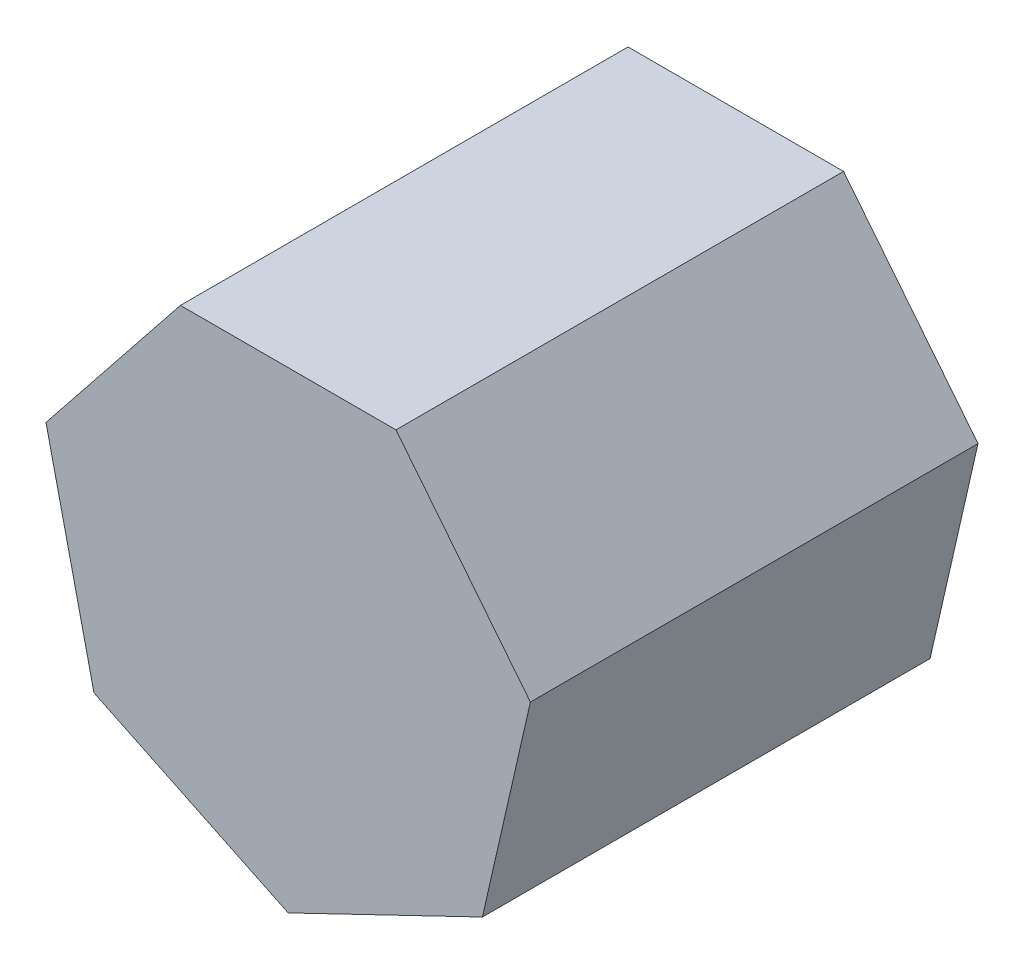
from build123d import *

# Parameters (mm, degrees)
BOSS_EXTRUDE1_DEPTH = 200
CUT_EXTRUDE1_DEPTH  = 1


with BuildPart() as part:
    # Sketch1 → Boss-Extrude1 (new body)
    with BuildSketch(Plane.XY):
        Polygon((0, -110.991626417), (86.776747824, -69.202147163), (108.208834613, 24.697960372), (48.157461881, 100), (-48.157461881, 100), (-108.208834613, 24.697960372), (-86.776747824, -69.202147163), align=None)
    extrude(amount=BOSS_EXTRUDE1_DEPTH)

    # Sketch2 → Cut-Extrude1 (cut)
    # profile 1 of 6: a face of its own
    with BuildSketch(Plane(origin=(-78.183148247, 62.348980186, 0), x_dir=(0, 0, 1), z_dir=(-0.7818314824680302, 0.6234898018587328, 0))):
        with BuildLine():
            Line((145.128205128, -35.364993932), (143.91025641, -36.619000342))
            add(Edge.make_bspline(
                [(143.91025641, -36.619000342), (143.805167819, -36.497210935), (143.602569386, -36.262415294), (143.281246637, -35.9484892), (142.961111759, -35.684849549), (142.64654711, -35.462265212), (142.329642716, -35.293984375), (142.014117469, -35.171156592), (141.699644678, -35.095146274), (141.489438762, -35.085349481), (141.386217949, -35.080538804)],
                knots=[0, 0, 0, 0, 1.26578478, 2.440284043, 3.530471711, 4.527705817, 5.468200915, 6.346673037, 7.188140097, 8, 8, 8, 8], degree=3))
            add(Edge.make_bspline(
                [(141.386217949, -35.080538804), (141.25970715, -35.086680935), (141.010751801, -35.09876778), (140.65403284, -35.219415954), (140.322886411, -35.404608745), (140.036275097, -35.667286365), (139.793488354, -35.968796473), (139.616267319, -36.305918329), (139.50789027, -36.668478579), (139.494148944, -36.920077766), (139.487179487, -37.04768624)],
                knots=[0, 0, 0, 0, 0.99966794, 1.967205029, 2.953328237, 3.988086729, 5.028030931, 6.008226631, 6.989793394, 8, 8, 8, 8], degree=3))
            add(Edge.make_bspline(
                [(139.487179487, -37.04768624), (139.493526986, -37.163183635), (139.50620409, -37.39385284), (139.604756542, -37.734127319), (139.761705526, -38.065881823), (139.908392351, -38.26909843), (139.983974359, -38.373808035)],
                knots=[0, 0, 0, 0, 0.960159726, 1.917612774, 2.927026955, 4, 4, 4, 4], degree=3))
            add(Edge.make_bspline(
                [(139.983974359, -38.373808035), (140.029480038, -38.429719945), (140.126333139, -38.5487214), (140.308096082, -38.713886276), (140.513938956, -38.896413425), (140.761481457, -39.078909636), (141.040058759, -39.271090923), (141.355711812, -39.465388826), (141.698423269, -39.676614111), (141.943779307, -39.810582314), (142.071314103, -39.880218291)],
                knots=[0, 0, 0, 0, 0.66740084, 1.420478572, 2.27185888, 3.217733974, 4.268547843, 5.408967954, 6.65319498, 8, 8, 8, 8], degree=3))
            add(Edge.make_bspline(
                [(142.071314103, -39.880218291), (142.226820257, -39.967332021), (142.527206943, -40.135607064), (142.954022756, -40.396805369), (143.341377276, -40.656413508), (143.69255252, -40.911655073), (144.000791428, -41.169671459), (144.275446014, -41.420572928), (144.509665694, -41.671940404), (144.640830989, -41.847558196), (144.703525641, -41.931500342)],
                knots=[0, 0, 0, 0, 1.27191281, 2.456916733, 3.569705269, 4.599008579, 5.553216877, 6.436649441, 7.252746552, 8, 8, 8, 8], degree=3))
            add(Edge.make_bspline(
                [(144.703525641, -41.931500342), (144.807585798, -42.101020845), (145.014684822, -42.438398109), (145.232160631, -42.99393198), (145.358219344, -43.583134851), (145.375717745, -43.986176109), (145.384615385, -44.191115727)],
                knots=[0, 0, 0, 0, 0.995354457, 1.980940102, 2.973342416, 4, 4, 4, 4], degree=3))
            add(Edge.make_bspline(
                [(145.384615385, -44.191115727), (145.380503763, -44.335510848), (145.372401363, -44.620057209), (145.316069552, -45.039113379), (145.219183973, -45.439882279), (145.087219665, -45.826712477), (144.909023248, -46.192192132), (144.700178693, -46.545542126), (144.449464911, -46.879118874), (144.163228479, -47.19248436), (143.849825657, -47.478688631), (143.515504866, -47.730254082), (143.159854405, -47.939250295), (142.78541554, -48.112195125), (142.391337517, -48.249728027), (141.977558721, -48.344942491), (141.545394409, -48.401929698), (141.251509791, -48.40984099), (141.101762821, -48.413872137)],
                knots=[0, 0, 0, 0, 1.032770009, 2.035186124, 3.017557409, 3.978232242, 4.952395191, 5.920591857, 6.910227898, 7.931268572, 8.952309245, 9.941945286, 10.918353717, 11.897095711, 12.887975737, 13.898235213, 14.929059601, 16, 16, 16, 16], degree=3))
            add(Edge.make_bspline(
                [(141.101762821, -48.413872137), (140.899664675, -48.408199564), (140.498276521, -48.396933237), (139.904620983, -48.291184316), (139.324502362, -48.126639208), (138.762310703, -47.899691013), (138.230618624, -47.613115511), (137.744156198, -47.269901833), (137.301233555, -46.881387562), (137.049129134, -46.583599501), (136.923076923, -46.43470547)],
                knots=[0, 0, 0, 0, 1.013940152, 2.01379169, 3.017749504, 4.037548394, 5.051665909, 6.043208538, 7.021604269, 8, 8, 8, 8], degree=3))
            Line((136.923076923, -46.43470547), (138.112980769, -45.080538804))
            add(Edge.make_bspline(
                [(138.112980769, -45.080538804), (138.225965986, -45.20256603), (138.445004913, -45.439134258), (138.795297581, -45.75413049), (139.151751301, -46.018137754), (139.510806653, -46.238957267), (139.877778621, -46.409102428), (140.250610702, -46.52863725), (140.628544554, -46.605461206), (140.88238533, -46.614479962), (141.009615385, -46.619000342)],
                knots=[0, 0, 0, 0, 1.179806542, 2.287233372, 3.337373186, 4.324005949, 5.273901747, 6.200048787, 7.097828587, 8, 8, 8, 8], degree=3))
            add(Edge.make_bspline(
                [(141.009615385, -46.619000342), (141.182860676, -46.611167057), (141.521352913, -46.595862133), (142.006174391, -46.456907321), (142.453823685, -46.239021882), (142.842528517, -45.929966464), (143.173398009, -45.570220335), (143.412987577, -45.164996796), (143.563137151, -44.726188472), (143.580771429, -44.422003886), (143.58974359, -44.267237522)],
                knots=[0, 0, 0, 0, 1.072336372, 2.095165389, 3.102688358, 4.141489647, 5.156069229, 6.117746104, 7.042326257, 8, 8, 8, 8], degree=3))
            add(Edge.make_bspline(
                [(143.58974359, -44.267237522), (143.583536194, -44.139753987), (143.571280521, -43.888054811), (143.475033252, -43.523767148), (143.322959811, -43.178228402), (143.173218963, -42.976001846), (143.096955128, -42.873006753)],
                knots=[0, 0, 0, 0, 1.013901739, 2.00181326, 2.98231254, 4, 4, 4, 4], degree=3))
            add(Edge.make_bspline(
                [(143.096955128, -42.873006753), (143.051112874, -42.821376112), (142.951251889, -42.708905929), (142.768079082, -42.546476907), (142.548754155, -42.371402054), (142.290810367, -42.186650118), (141.993727727, -41.994658087), (141.656302153, -41.796433217), (141.283156139, -41.582560499), (141.01932396, -41.440733897), (140.881410256, -41.366596496)],
                knots=[0, 0, 0, 0, 0.615000592, 1.339693406, 2.178160186, 3.116406724, 4.166410947, 5.330106347, 6.604359322, 8, 8, 8, 8], degree=3))
            add(Edge.make_bspline(
                [(140.881410256, -41.366596496), (140.732572313, -41.283515744), (140.443928042, -41.122395651), (140.035086379, -40.871446621), (139.666244355, -40.616205051), (139.328526786, -40.370988827), (139.030463897, -40.122869147), (138.773229907, -39.871570567), (138.546697245, -39.62722779), (138.421283463, -39.45410038), (138.361378205, -39.371404188)],
                knots=[0, 0, 0, 0, 1.262093308, 2.447601706, 3.550203992, 4.582594899, 5.537233252, 6.418365656, 7.244515135, 8, 8, 8, 8], degree=3))
            add(Edge.make_bspline(
                [(138.361378205, -39.371404188), (138.257774779, -39.204857817), (138.05053172, -38.871706872), (137.849302056, -38.315647005), (137.710981891, -37.730246678), (137.698625376, -37.326321796), (137.692307692, -37.119801624)],
                knots=[0, 0, 0, 0, 0.985009483, 1.970363186, 2.962279964, 4, 4, 4, 4], degree=3))
            add(Edge.make_bspline(
                [(137.692307692, -37.119801624), (137.695360237, -36.98479935), (137.701334499, -36.720580773), (137.749014794, -36.332358943), (137.835824572, -35.96351235), (137.944709844, -35.608501704), (138.096041298, -35.274204024), (138.276875042, -34.956161332), (138.489374613, -34.654813229), (138.734193418, -34.374795331), (139.003374248, -34.120456324), (139.294201504, -33.898749878), (139.600134398, -33.709570708), (139.922468224, -33.550912648), (140.264299498, -33.430904747), (140.623238849, -33.348291118), (140.998559734, -33.293118531), (141.255137597, -33.28818662), (141.386217949, -33.285667009)],
                knots=[0, 0, 0, 0, 1.087655834, 2.128696564, 3.144119009, 4.137814668, 5.115653402, 6.093965665, 7.082169637, 8.081268856, 9.086088321, 10.061021666, 11.022561449, 11.980240094, 12.950172527, 13.934149372, 14.944599409, 16, 16, 16, 16], degree=3))
            add(Edge.make_bspline(
                [(141.386217949, -33.285667009), (141.541601169, -33.291977527), (141.855282436, -33.304716943), (142.325880299, -33.405892317), (142.795785111, -33.572367198), (143.266204254, -33.802288531), (143.733691622, -34.099813536), (144.202359374, -34.459409533), (144.677833833, -34.878710759), (144.974727051, -35.199277761), (145.128205128, -35.364993932)],
                knots=[0, 0, 0, 0, 0.845714091, 1.707292901, 2.609013841, 3.555613372, 4.552488639, 5.621697636, 6.770543573, 8, 8, 8, 8], degree=3))
        make_face()
    # profile 2 of 6: a face of its own
    with BuildSketch(Plane(origin=(-78.183148247, 62.348980186, 0), x_dir=(0, 0, 1), z_dir=(-0.7818314824680302, 0.6234898018587328, 0))):
        with BuildLine():
            Line((132.251602564, -43.542077265), (133.846153846, -44.379417009))
            add(Edge.make_bspline(
                [(133.846153846, -44.379417009), (133.719087588, -44.604807473), (133.471866968, -45.043328061), (133.046719837, -45.645795835), (132.601050851, -46.187782783), (132.114742462, -46.654809379), (131.602344297, -47.06196015), (131.061014841, -47.418176291), (130.487935882, -47.721710693), (129.883080312, -47.977439424), (129.241368591, -48.174065104), (128.56124564, -48.312946367), (127.841408524, -48.398793616), (127.348001782, -48.408765849), (127.095352564, -48.413872137)],
                knots=[0, 0, 0, 0, 1.120438281, 2.179929193, 3.190490725, 4.156257408, 5.095198341, 6.022838206, 6.959905092, 7.901321166, 8.864066838, 9.862729781, 10.905609505, 12, 12, 12, 12], degree=3))
            add(Edge.make_bspline(
                [(127.095352564, -48.413872137), (126.814541264, -48.40731685), (126.266759769, -48.394529383), (125.469389785, -48.284286729), (124.718650252, -48.104444679), (124.014583375, -47.853213013), (123.35891336, -47.525056876), (122.750337047, -47.125288408), (122.185654042, -46.655961239), (121.682658561, -46.113010133), (121.229836374, -45.531970377), (120.83026026, -44.92650818), (120.496217797, -44.298146897), (120.224488596, -43.65088676), (120.005032225, -42.988807368), (119.852079632, -42.305884696), (119.763909643, -41.603967072), (119.750398526, -41.129125154), (119.743589744, -40.889833676)],
                knots=[0, 0, 0, 0, 1.145258523, 2.234067595, 3.276747158, 4.290159414, 5.277019952, 6.260822364, 7.254936242, 8.264827045, 9.274100331, 10.257902744, 11.220704747, 12.172965371, 13.118907548, 14.062713208, 15.023725156, 16, 16, 16, 16], degree=3))
            add(Edge.make_bspline(
                [(119.743589744, -40.889833676), (119.74964198, -40.665291788), (119.761636713, -40.220279418), (119.837241212, -39.561619163), (119.971231458, -38.921456578), (120.155096166, -38.299259732), (120.392531859, -37.696070395), (120.683001683, -37.11152146), (121.026958127, -36.546234946), (121.292516263, -36.189645611), (121.426282051, -36.010025983)],
                knots=[0, 0, 0, 0, 1.024358464, 2.0301432, 3.019427413, 4.004406732, 4.986367066, 5.972626655, 6.978780325, 8, 8, 8, 8], degree=3))
            add(Edge.make_bspline(
                [(121.426282051, -36.010025983), (121.60746881, -35.79363244), (121.964102791, -35.367700152), (122.567281964, -34.808052576), (123.220425943, -34.339231003), (123.915349521, -33.950618797), (124.660129373, -33.655340814), (125.444753893, -33.435297487), (126.278157243, -33.311994567), (126.847901362, -33.294578375), (127.139423077, -33.285667009)],
                knots=[0, 0, 0, 0, 1.030682036, 2.02871468, 2.997146059, 3.962720338, 4.930598197, 5.918074684, 6.934738563, 8, 8, 8, 8], degree=3))
            add(Edge.make_bspline(
                [(127.139423077, -33.285667009), (127.439123679, -33.293404431), (128.027067941, -33.30858349), (128.884394347, -33.449305395), (129.695598442, -33.67246285), (130.460355609, -33.987627367), (131.178743385, -34.394253377), (131.84609224, -34.897921043), (132.473815168, -35.483167255), (132.839007048, -35.933242738), (133.024839744, -36.162269573)],
                knots=[0, 0, 0, 0, 1.056321875, 2.072262726, 3.055038591, 4.01806755, 4.982017516, 5.957941055, 6.960871419, 8, 8, 8, 8], degree=3))
            add(Edge.make_bspline(
                [(133.024839744, -36.162269573), (133.151279391, -36.334861467), (133.403317066, -36.678896431), (133.71901478, -37.239874471), (133.993057037, -37.826792153), (134.212102529, -38.449136708), (134.389471107, -39.099534309), (134.517795786, -39.782634564), (134.593050749, -40.498234058), (134.607843305, -40.985814375), (134.615384615, -41.234384958)],
                knots=[0, 0, 0, 0, 0.94817472, 1.890038105, 2.849395472, 3.817997239, 4.812318967, 5.836947057, 6.897266129, 8, 8, 8, 8], degree=3))
            Line((134.615384615, -41.234384958), (121.538461538, -41.234384958))
            add(Edge.make_bspline(
                [(121.538461538, -41.234384958), (121.547259289, -41.426959039), (121.564559712, -41.805648203), (121.645217673, -42.359766964), (121.772353523, -42.887614633), (121.951033881, -43.385232016), (122.167415854, -43.859118459), (122.432477093, -44.30575867), (122.748703115, -44.723118271), (123.101421398, -45.114930485), (123.494033371, -45.463849121), (123.907077641, -45.776144985), (124.346469441, -46.037891252), (124.808744203, -46.250347765), (125.293154404, -46.416669571), (125.799852662, -46.530199975), (126.327841898, -46.606240585), (126.687760379, -46.614695815), (126.87099359, -46.619000342)],
                knots=[0, 0, 0, 0, 1.094153842, 2.151609401, 3.174256925, 4.172055639, 5.149267565, 6.128595816, 7.11444997, 8.118368179, 9.117203808, 10.09244225, 11.054858984, 12.015122123, 12.976791628, 13.957293641, 14.960065497, 16, 16, 16, 16], degree=3))
            add(Edge.make_bspline(
                [(126.87099359, -46.619000342), (127.050143005, -46.615525733), (127.40560981, -46.608631441), (127.934986138, -46.54159195), (128.455783437, -46.433190375), (128.965846199, -46.285247575), (129.454822461, -46.10480842), (129.907654176, -45.887077805), (130.324112551, -45.646222109), (130.71335236, -45.370738252), (131.090900893, -45.033548612), (131.465429387, -44.612773063), (131.867010263, -44.115130047), (132.118379365, -43.740583384), (132.251602564, -43.542077265)],
                knots=[0, 0, 0, 0, 0.99110716, 1.966546729, 2.947904876, 3.932708344, 4.903319531, 5.828989031, 6.710028674, 7.56322171, 8.463672341, 9.504779593, 10.677557249, 12, 12, 12, 12], degree=3))
        make_face()
        with BuildLine():
            add(Edge.make_bspline(
                [(132.820512821, -39.439513163), (132.754817823, -39.201439599), (132.6283761, -38.743224624), (132.364168303, -38.10870525), (132.066616642, -37.544774387), (131.714492463, -37.055747912), (131.315528317, -36.621442124), (130.854698701, -36.241907352), (130.337922167, -35.90237906), (129.767869935, -35.615793349), (129.164202592, -35.371851299), (128.532167209, -35.208279209), (127.887265564, -35.096224681), (127.451069642, -35.085789776), (127.231570513, -35.080538804)],
                knots=[0, 0, 0, 0, 1.154881502, 2.222775134, 3.210006277, 4.132804581, 5.035138423, 5.962687519, 6.919655026, 7.923214229, 8.944639381, 9.960483929, 10.97369054, 12, 12, 12, 12], degree=3))
            add(Edge.make_bspline(
                [(127.231570513, -35.080538804), (127.052430864, -35.08403407), (126.698309441, -35.090943476), (126.176589051, -35.156487072), (125.6755622, -35.264829043), (125.191531985, -35.413200223), (124.730841309, -35.610963666), (124.284014062, -35.842867818), (123.862411798, -36.125962583), (123.598747252, -36.341727468), (123.465544872, -36.450731112)],
                knots=[0, 0, 0, 0, 1.04873581, 2.073130211, 3.073294108, 4.04793562, 5.032784715, 6.005352987, 6.992311501, 8, 8, 8, 8], degree=3))
            add(Edge.make_bspline(
                [(123.465544872, -36.450731112), (123.370154689, -36.536984344), (123.177108208, -36.711539864), (122.919162371, -37.012278187), (122.672188241, -37.336572828), (122.447424511, -37.696830683), (122.241266874, -38.08894942), (122.048352719, -38.509621621), (121.874716078, -38.962039509), (121.777024021, -39.27731059), (121.726762821, -39.439513163)],
                knots=[0, 0, 0, 0, 0.879870761, 1.780643979, 2.707998968, 3.669668524, 4.684282772, 5.740141944, 6.837334558, 8, 8, 8, 8], degree=3))
            Line((121.726762821, -39.439513163), (132.820512821, -39.439513163))
        make_face(mode=Mode.SUBTRACT)
    # profile 3 of 6: a face of its own
    with BuildSketch(Plane(origin=(-78.183148247, 62.348980186, 0), x_dir=(0, 0, 1), z_dir=(-0.7818314824680302, 0.6234898018587328, 0))):
        with BuildLine():
            Line((111.538461538, -33.542077265), (113.333333333, -33.542077265))
            Line((113.333333333, -33.542077265), (113.333333333, -35.693519573))
            add(Edge.make_bspline(
                [(113.333333333, -35.693519573), (113.465840526, -35.493200554), (113.719259503, -35.110091987), (114.140476242, -34.603410267), (114.571923849, -34.183895715), (115.015667777, -33.849589893), (115.474971205, -33.599229214), (115.939753786, -33.415840442), (116.4173279, -33.307398641), (116.738253181, -33.29292059), (116.899038462, -33.285667009)],
                knots=[0, 0, 0, 0, 1.2804753, 2.448899062, 3.506932113, 4.484331642, 5.4025378, 6.288909075, 7.142734305, 8, 8, 8, 8], degree=3))
            add(Edge.make_bspline(
                [(116.899038462, -33.285667009), (117.023760327, -33.292470018), (117.280383671, -33.306467651), (117.668855613, -33.404815221), (118.06910391, -33.561832493), (118.327060408, -33.709490908), (118.461538462, -33.786468291)],
                knots=[0, 0, 0, 0, 0.901110191, 1.854092781, 2.881294221, 4, 4, 4, 4], degree=3))
            Line((118.461538462, -33.786468291), (117.475961538, -35.34095547))
            add(Edge.make_bspline(
                [(117.475961538, -35.34095547), (117.389624275, -35.302439664), (117.22573962, -35.22932929), (116.985999242, -35.142803518), (116.764963032, -35.091855428), (116.624142698, -35.084137042), (116.55849359, -35.080538804)],
                knots=[0, 0, 0, 0, 1.180555205, 2.24091978, 3.179933427, 4, 4, 4, 4], degree=3))
            add(Edge.make_bspline(
                [(116.55849359, -35.080538804), (116.414460827, -35.090139017), (116.120675741, -35.10972067), (115.689335745, -35.263656715), (115.270780285, -35.512372372), (114.938370786, -35.788207297), (114.680986483, -36.054194711), (114.497328052, -36.286471297), (114.328855212, -36.54692062), (114.167882524, -36.831090242), (114.021217986, -37.143832219), (113.884334162, -37.48202201), (113.760569231, -37.846051318), (113.689996407, -38.099665719), (113.653846154, -38.229577265)],
                knots=[0, 0, 0, 0, 1.125678352, 2.296057538, 3.5422874, 4.923748041, 5.663163013, 6.437101912, 7.23742474, 8.08941207, 8.991984279, 9.93940061, 10.944477711, 12, 12, 12, 12], degree=3))
            add(Edge.make_bspline(
                [(113.653846154, -38.229577265), (113.626803906, -38.345446829), (113.566907382, -38.602089107), (113.508670023, -39.032652105), (113.45112992, -39.541358727), (113.410577815, -40.129624972), (113.372989003, -40.795981794), (113.351788533, -41.54144434), (113.334056302, -42.366777776), (113.333581634, -42.94377408), (113.333333333, -43.245602906)],
                knots=[0, 0, 0, 0, 0.566838948, 1.255505196, 2.06880316, 3.007127437, 4.065329342, 5.249902469, 6.561414163, 8, 8, 8, 8], degree=3))
            Line((113.333333333, -43.245602906), (113.333333333, -48.157461881))
            Line((113.333333333, -48.157461881), (111.538461538, -48.157461881))
            Line((111.538461538, -48.157461881), (111.538461538, -33.542077265))
        make_face()
    # profile 4 of 6: a face of its own
    with BuildSketch(Plane(origin=(-78.183148247, 62.348980186, 0), x_dir=(0, 0, 1), z_dir=(-0.7818314824680302, 0.6234898018587328, 0))):
        with BuildLine():
            Line((107.948717949, -27.644641368), (107.948717949, -48.157461881))
            Line((107.948717949, -48.157461881), (106.153846154, -48.157461881))
            Line((106.153846154, -48.157461881), (106.153846154, -45.629417009))
            add(Edge.make_bspline(
                [(106.153846154, -45.629417009), (105.951453065, -45.858214689), (105.556480406, -46.304716238), (104.896816875, -46.888042938), (104.197570144, -47.370204775), (103.462134023, -47.759632865), (102.691172632, -48.052158901), (101.886394991, -48.26007981), (101.047472814, -48.393758868), (100.474602216, -48.407107565), (100.184294872, -48.413872137)],
                knots=[0, 0, 0, 0, 1.074387032, 2.096679803, 3.090159297, 4.057316773, 5.018401886, 5.985159533, 6.978961417, 8, 8, 8, 8], degree=3))
            add(Edge.make_bspline(
                [(100.184294872, -48.413872137), (99.926192278, -48.406864296), (99.417202536, -48.393044522), (98.668464953, -48.285831358), (97.947937813, -48.113656377), (97.254940255, -47.874222723), (96.593956567, -47.556618028), (95.959327443, -47.176382325), (95.354340631, -46.723577582), (94.788217551, -46.205931705), (94.266891835, -45.643674636), (93.809398849, -45.043985797), (93.427952678, -44.409458346), (93.108980788, -43.748126038), (92.863287391, -43.054897926), (92.692009481, -42.332171252), (92.584921215, -41.580800546), (92.571107153, -41.069146129), (92.564102564, -40.80970547)],
                knots=[0, 0, 0, 0, 1.033919861, 2.038935746, 3.024066025, 3.998881131, 4.97069526, 5.957263378, 6.95902576, 7.993208707, 9.027059324, 10.027763471, 11.009749337, 11.988697705, 12.965288445, 13.950418724, 14.960734635, 16, 16, 16, 16], degree=3))
            add(Edge.make_bspline(
                [(92.564102564, -40.80970547), (92.571262401, -40.555627164), (92.585417011, -40.05332806), (92.690863982, -39.314592643), (92.868184031, -38.603059724), (93.117028875, -37.921020049), (93.43612576, -37.267648333), (93.824286258, -36.642482476), (94.281538399, -36.043800205), (94.80869501, -35.485678909), (95.37975084, -34.970132542), (95.990657874, -34.522080853), (96.626219481, -34.135127432), (97.296293827, -33.828536138), (97.990962997, -33.580484112), (98.716411259, -33.408867152), (99.46962028, -33.307739602), (99.98099452, -33.293095235), (100.240384615, -33.285667009)],
                knots=[0, 0, 0, 0, 1.020392517, 2.01726096, 2.990465484, 3.961182959, 4.928053699, 5.906110375, 6.912531644, 7.948652711, 8.985773172, 9.998621852, 10.987621588, 11.969261332, 12.953316658, 13.946091881, 14.958173133, 16, 16, 16, 16], degree=3))
            add(Edge.make_bspline(
                [(100.240384615, -33.285667009), (100.538766374, -33.294621843), (101.124456606, -33.312199188), (101.981019586, -33.459092714), (102.791234504, -33.70573773), (103.559765861, -34.043402195), (104.282031919, -34.482263631), (104.963327008, -35.012271904), (105.591803139, -35.648427025), (105.963642125, -36.126207444), (106.153846154, -36.370602906)],
                knots=[0, 0, 0, 0, 1.031072012, 2.023879775, 2.993683497, 3.952812103, 4.918022106, 5.908088563, 6.929940113, 8, 8, 8, 8], degree=3))
            Line((106.153846154, -36.370602906), (106.153846154, -27.644641368))
            Line((106.153846154, -27.644641368), (107.948717949, -27.644641368))
        make_face()
        with BuildLine():
            add(Edge.make_bspline(
                [(100.264423077, -35.080538804), (100.002055432, -35.089873877), (99.484183432, -35.108299825), (98.723931992, -35.252148369), (97.996426768, -35.491488909), (97.305306344, -35.818814058), (96.661487963, -36.230406839), (96.086095559, -36.728243315), (95.574422979, -37.298740538), (95.144090041, -37.939324026), (94.793287201, -38.626055975), (94.546618447, -39.343909907), (94.383937034, -40.07993835), (94.367316916, -40.579153698), (94.358974359, -40.829737522)],
                knots=[0, 0, 0, 0, 1.031046209, 2.035121221, 3.029706178, 4.034933723, 5.034054252, 6.02443088, 7.017295772, 8.038157696, 9.050218397, 10.03989886, 11.016116709, 12, 12, 12, 12], degree=3))
            add(Edge.make_bspline(
                [(94.358974359, -40.829737522), (94.369630892, -41.078823849), (94.390902189, -41.576020168), (94.543763299, -42.313052035), (94.800219719, -43.031075133), (95.150174363, -43.723995095), (95.588383647, -44.367332812), (96.096318805, -44.948704941), (96.678891841, -45.448645445), (97.324191881, -45.867145866), (98.013380284, -46.205217414), (98.738145606, -46.44044964), (99.484863539, -46.592322672), (99.992591161, -46.610062539), (100.248397436, -46.619000342)],
                knots=[0, 0, 0, 0, 0.979072187, 1.954306742, 2.945804271, 3.96968567, 4.997920485, 5.998718438, 6.996577872, 8.005894225, 9.015743152, 10.005417472, 10.995077863, 12, 12, 12, 12], degree=3))
            add(Edge.make_bspline(
                [(100.248397436, -46.619000342), (100.508091737, -46.609514834), (101.024597946, -46.590649099), (101.787104848, -46.446184726), (102.527076064, -46.207505878), (103.234431655, -45.876653726), (103.893380976, -45.466611692), (104.484797419, -44.986571172), (104.984888667, -44.428267263), (105.408846436, -43.814687531), (105.741277389, -43.142047551), (105.983426298, -42.425852175), (106.126591474, -41.666076472), (106.144635644, -41.146854032), (106.153846154, -40.881820855)],
                knots=[0, 0, 0, 0, 1.01762866, 2.023962475, 3.030623092, 4.058876274, 5.077231937, 6.066672613, 7.034107872, 8.005628644, 8.981990164, 9.965428785, 10.961468474, 12, 12, 12, 12], degree=3))
            add(Edge.make_bspline(
                [(106.153846154, -40.881820855), (106.148362403, -40.679890395), (106.137568646, -40.282427347), (106.055108249, -39.698841533), (105.923937241, -39.140363098), (105.739101984, -38.606404875), (105.496294644, -38.099919073), (105.203450268, -37.617269014), (104.855419126, -37.160964949), (104.45780372, -36.737290258), (104.022573991, -36.350853331), (103.562033759, -36.005914812), (103.070726634, -35.722550397), (102.556914994, -35.488028845), (102.019707369, -35.301405132), (101.454732398, -35.176904024), (100.86799533, -35.091416476), (100.467732156, -35.084202871), (100.264423077, -35.080538804)],
                knots=[0, 0, 0, 0, 1.050140795, 2.067009409, 3.05949893, 4.030605086, 5.00011959, 5.97591094, 6.962425594, 7.979863591, 8.993523472, 9.986985069, 10.967611495, 11.937549037, 12.921786183, 13.919465291, 14.943216303, 16, 16, 16, 16], degree=3))
        make_face(mode=Mode.SUBTRACT)
    # profile 5 of 6: a face of its own
    with BuildSketch(Plane(origin=(-78.183148247, 62.348980186, 0), x_dir=(0, 0, 1), z_dir=(-0.7818314824680302, 0.6234898018587328, 0))):
        with BuildLine():
            Line((76.153846154, -33.542077265), (77.948717949, -33.542077265))
            Line((77.948717949, -33.542077265), (77.948717949, -36.178295214))
            add(Edge.make_bspline(
                [(77.948717949, -36.178295214), (78.140361578, -35.939193941), (78.512252727, -35.475209578), (79.131591774, -34.865377723), (79.786128347, -34.36283358), (80.471854082, -33.962240472), (81.189699854, -33.660259751), (81.935289968, -33.442168716), (82.713088288, -33.311398268), (83.242027928, -33.294311237), (83.509615385, -33.285667009)],
                knots=[0, 0, 0, 0, 1.12780773, 2.188550248, 3.19190651, 4.159438251, 5.104880172, 6.052711206, 7.014878035, 8, 8, 8, 8], degree=3))
            add(Edge.make_bspline(
                [(83.509615385, -33.285667009), (83.780076151, -33.295639554), (84.30943311, -33.315158231), (85.080164889, -33.469539323), (85.800012853, -33.733226495), (86.466410315, -34.094438326), (87.067137248, -34.543618174), (87.594707828, -35.066919784), (88.031069241, -35.66884026), (88.323625601, -36.227258296), (88.516343588, -36.722622834), (88.637671231, -37.146889978), (88.740705411, -37.619565127), (88.830029685, -38.139219922), (88.890470325, -38.709495295), (88.938140562, -39.328053535), (88.972304529, -39.994694281), (88.973659998, -40.455760723), (88.974358974, -40.693519573)],
                knots=[0, 0, 0, 0, 1.235846778, 2.418850247, 3.575807741, 4.728682307, 5.871620074, 6.994088408, 8.11269785, 9.256955736, 9.865816715, 10.540099792, 11.271859618, 12.076849838, 12.949306005, 13.892391288, 14.913166135, 16, 16, 16, 16], degree=3))
            Line((88.974358974, -40.693519573), (88.974358974, -48.157461881))
            Line((88.974358974, -48.157461881), (87.179487179, -48.157461881))
            Line((87.179487179, -48.157461881), (87.179487179, -41.282461881))
            add(Edge.make_bspline(
                [(87.179487179, -41.282461881), (87.178383134, -41.083476481), (87.176271282, -40.702851277), (87.169610444, -40.15788543), (87.153554406, -39.66367641), (87.130992618, -39.22140574), (87.097969586, -38.831498102), (87.06355455, -38.493159378), (87.021468968, -38.206819135), (86.983966608, -38.034447236), (86.967147436, -37.957141368)],
                knots=[0, 0, 0, 0, 1.430800155, 2.736877192, 3.918605307, 4.986035426, 5.920637409, 6.731861385, 7.431261377, 8, 8, 8, 8], degree=3))
            add(Edge.make_bspline(
                [(86.967147436, -37.957141368), (86.906430113, -37.730220311), (86.789568052, -37.293467485), (86.500802434, -36.701042613), (86.136149973, -36.197052968), (85.691019405, -35.784614559), (85.169710401, -35.463638349), (84.573669585, -35.240930036), (83.908648781, -35.101637069), (83.440909452, -35.087767743), (83.197115385, -35.080538804)],
                knots=[0, 0, 0, 0, 1.084156227, 2.086665306, 3.027808233, 3.945421172, 4.874247719, 5.839848303, 6.874090471, 8, 8, 8, 8], degree=3))
            add(Edge.make_bspline(
                [(83.197115385, -35.080538804), (83.052728621, -35.08325883), (82.766990947, -35.088641693), (82.343276822, -35.14264911), (81.932281546, -35.230983142), (81.529880352, -35.350232499), (81.144121531, -35.514016895), (80.762611295, -35.69989901), (80.3997155, -35.931603079), (80.047696088, -36.189835201), (79.72019433, -36.4760021), (79.415460968, -36.777970729), (79.143815138, -37.099545608), (78.897708422, -37.435545308), (78.685261203, -37.790584382), (78.499814985, -38.161237562), (78.342468158, -38.547992698), (78.264281344, -38.81642162), (78.225160256, -38.950731112)],
                knots=[0, 0, 0, 0, 1.023777757, 2.026029729, 3.023749952, 4.003683103, 4.997618607, 5.993177895, 7.010360494, 8.046726602, 9.087585522, 10.09234134, 11.086953743, 12.070360549, 13.043493632, 14.017870808, 15.008233677, 16, 16, 16, 16], degree=3))
            add(Edge.make_bspline(
                [(78.225160256, -38.950731112), (78.202647979, -39.049332272), (78.153639928, -39.26398184), (78.100707472, -39.616235665), (78.052664184, -40.023721236), (78.012452992, -40.485963048), (77.987850612, -41.004579477), (77.961025487, -41.577355693), (77.951259424, -42.206575627), (77.94958883, -42.644642442), (77.948717949, -42.873006753)],
                knots=[0, 0, 0, 0, 0.615963638, 1.340920617, 2.168419149, 3.115676021, 4.16674242, 5.331190069, 6.6087489, 8, 8, 8, 8], degree=3))
            Line((77.948717949, -42.873006753), (77.948717949, -48.157461881))
            Line((77.948717949, -48.157461881), (76.153846154, -48.157461881))
            Line((76.153846154, -48.157461881), (76.153846154, -33.542077265))
        make_face()
    # profile 6 of 6: a face of its own
    with BuildSketch(Plane(origin=(-78.183148247, 62.348980186, 0), x_dir=(0, 0, 1), z_dir=(-0.7818314824680302, 0.6234898018587328, 0))):
        Polygon((63.846153846, -28.157461881), (73.076923077, -48.157461881), (71.125801282, -48.157461881), (68.169070513, -41.74720547), (59.102564103, -41.74720547), (56.065705128, -48.157461881), (54.102564103, -48.157461881), (63.58974359, -28.157461881), align=None)
        Polygon((63.697916667, -32.05970547), (60.080128205, -39.695923419), (67.223557692, -39.695923419), align=None, mode=Mode.SUBTRACT)
    extrude(amount=-CUT_EXTRUDE1_DEPTH, mode=Mode.SUBTRACT)


solid = part.part
